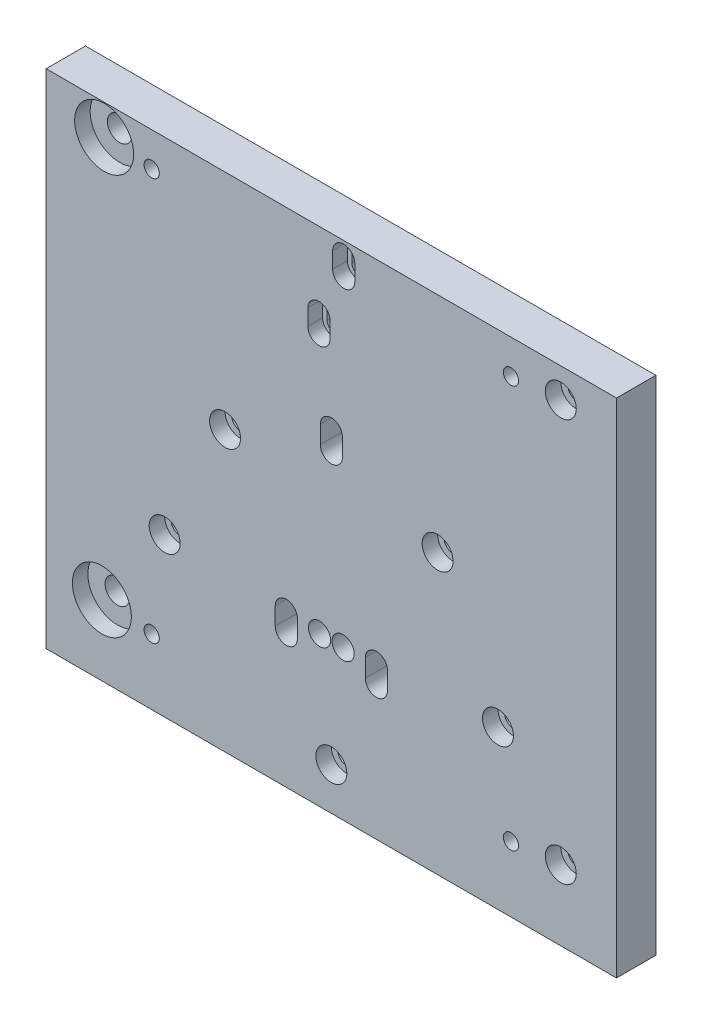
from build123d import *

# Parameters (mm, degrees)
SKETCH1_W                                      = 184.15
SKETCH1_H                                      = 146.05
BOSS_EXTRUDE1_DEPTH                            = 12.7
SKETCH5_W                                      = 184.15
SKETCH5_H                                      = 12.7
BOSS_EXTRUDE2_DEPTH                            = 16.125
CBORE_FOR_M5_SHCS2_D                           = 5.8
CBORE_FOR_M5_SHCS2_CBORE_D                     = 10
CBORE_FOR_M5_SHCS2_CBORE_DEPTH                 = 5
CBORE_FOR_M5_SHCS3_D                           = 5.3
CBORE_FOR_M5_SHCS3_CBORE_D                     = 10
CBORE_FOR_M5_SHCS3_CBORE_DEPTH                 = 5
CBORE_START                                    = 5.3848
CBORE_SLOT_FOR_6_SOCKET_HEAD_CAP_SCREW1_DEPTH  = 7.3152
CBORE_SLOT_FOR_6_SOCKET_HEAD_CAP_SC_3_DEPTH    = 5.3848
CBORE_FOR_6_SOCKET_HEAD_CAP_SCREW1_D           = 4.3053
CBORE_FOR_6_SOCKET_HEAD_CAP_SCREW1_CBORE_D     = 7.14502
CBORE_FOR_6_SOCKET_HEAD_CAP_SCREW1_CBORE_DEPTH = 7.3152
F_8_CLEARANCE_HOLE1_D                          = 4.9149
CBORE_SLOT_FOR_6_SOCKET_HEAD_CAP_SCREW2_DEPTH  = 12.7
CBORE_START_2                                  = 7.9248
CBORE_SLOT_FOR_6_SOCKET_HEAD_CAP_SC_5_DEPTH    = 4.7752
SKETCH24_R                                     = 9.525
CUT_EXTRUDE2_DEPTH                             = 3.175
CUT_EXTRUDE3_REACH                             = 286.439
SKETCH25_R                                     = 3.96875
SKETCH26_R                                     = 9.525
CUT_EXTRUDE4_DEPTH                             = 5


# Read off the part's stored shape, not the designer's step: CBORE SLOT for #6 Socket Head Cap Screw1, CBORE SLOT for #6 Socket Head Cap Screw2
with BuildPart() as part:
    # Sketch1 → Boss-Extrude1 (new body)
    with BuildSketch(Plane.XY):
        with Locations((-90.01, -129)):
            Rectangle(SKETCH1_W, SKETCH1_H)
    extrude(amount=BOSS_EXTRUDE1_DEPTH)

    # Sketch5 → Boss-Extrude2 (add)
    with BuildSketch(Plane.XZ.offset(202.025)):
        with Locations((-90.01, 6.35)):
            Rectangle(SKETCH5_W, SKETCH5_H)
    extrude(amount=BOSS_EXTRUDE2_DEPTH)

    # CBORE for M5 SHCS2 (through all)
    with Locations(Plane.XY.offset(12.7)):
        with Locations((-55.7, -127.988675216), (-124.32, -127.988675216), (-90.01, -204.53125), (-143.810885302, -167.1), (-36.209114698, -167.1)):
            CounterBoreHole(CBORE_FOR_M5_SHCS2_D / 2, CBORE_FOR_M5_SHCS2_CBORE_D / 2, CBORE_FOR_M5_SHCS2_CBORE_DEPTH)

    # CBORE for M5 SHCS3 (through all)
    with Locations(Plane.XY.offset(12.7)):
        with Locations((-15.925, -65.5), (-15.925, -195.488675216), (-164.095, -195.488675216), (-163.361007118, -65.792154837)):
            CounterBoreHole(CBORE_FOR_M5_SHCS3_D / 2, CBORE_FOR_M5_SHCS3_CBORE_D / 2, CBORE_FOR_M5_SHCS3_CBORE_DEPTH)

    # CBORE SLOT for _6 Socket Head Cap Sc 2 → CBORE SLOT for #6 Socket Head Cap Screw1 (cut)
    with BuildSketch(Plane.XY.offset(CBORE_START)):
        with BuildLine():
            Line((-71.896135914, -174.858973451), (-71.896135914, -169.131273451))
            ThreePointArc((-71.896135914, -169.131273451), (-75.468645914, -165.558763451), (-79.041155914, -169.131273451))
            Line((-79.041155914, -169.131273451), (-79.041155914, -174.858973451))
            ThreePointArc((-79.041155914, -174.858973451), (-75.468645914, -178.431483451), (-71.896135914, -174.858973451))
        make_face()
        with BuildLine():
            Line((-100.978844086, -174.858973451), (-100.978844086, -169.131273451))
            ThreePointArc((-100.978844086, -169.131273451), (-104.551354086, -165.558763451), (-108.123864086, -169.131273451))
            Line((-108.123864086, -169.131273451), (-108.123864086, -174.858973451))
            ThreePointArc((-108.123864086, -174.858973451), (-104.551354086, -178.431483451), (-100.978844086, -174.858973451))
        make_face()
        with BuildLine():
            Line((-86.43749, -116.838826563), (-86.43749, -111.111126563))
            ThreePointArc((-86.43749, -111.111126563), (-90.01, -107.538616563), (-93.58251, -111.111126563))
            Line((-93.58251, -111.111126563), (-93.58251, -116.838826563))
            ThreePointArc((-93.58251, -116.838826563), (-90.01, -120.411336563), (-86.43749, -116.838826563))
        make_face()
    extrude(amount=CBORE_SLOT_FOR_6_SOCKET_HEAD_CAP_SCREW1_DEPTH, mode=Mode.SUBTRACT)

    # CBORE SLOT for _6 Socket Head Cap Sc 3 o → CBORE SLOT for _6 Socket Head Cap Sc 3 (cut)
    with BuildSketch(Plane.XY):
        with BuildLine():
            Line((-73.569995914, -174.858973451), (-73.569995914, -169.131273451))
            ThreePointArc((-73.569995914, -169.131273451), (-75.468645914, -167.232623451), (-77.367295914, -169.131273451))
            Line((-77.367295914, -169.131273451), (-77.367295914, -174.858973451))
            ThreePointArc((-77.367295914, -174.858973451), (-75.468645914, -176.757623451), (-73.569995914, -174.858973451))
        make_face()
        with BuildLine():
            Line((-102.652704086, -174.858973451), (-102.652704086, -169.131273451))
            ThreePointArc((-102.652704086, -169.131273451), (-104.551354086, -167.232623451), (-106.450004086, -169.131273451))
            Line((-106.450004086, -169.131273451), (-106.450004086, -174.858973451))
            ThreePointArc((-106.450004086, -174.858973451), (-104.551354086, -176.757623451), (-102.652704086, -174.858973451))
        make_face()
        with BuildLine():
            Line((-88.11135, -116.838826563), (-88.11135, -111.111126563))
            ThreePointArc((-88.11135, -111.111126563), (-90.01, -109.212476563), (-91.90865, -111.111126563))
            Line((-91.90865, -111.111126563), (-91.90865, -116.838826563))
            ThreePointArc((-91.90865, -116.838826563), (-90.01, -118.737476563), (-88.11135, -116.838826563))
        make_face()
    extrude(amount=CBORE_SLOT_FOR_6_SOCKET_HEAD_CAP_SC_3_DEPTH, mode=Mode.SUBTRACT)

    # CBORE for #6 Socket Head Cap Screw1 (through all)
    with Locations(Plane.XY.offset(12.7)):
        with Locations((-93.82, -169.850123451), (-86.2, -169.850123451)):
            CounterBoreHole(CBORE_FOR_6_SOCKET_HEAD_CAP_SCREW1_D / 2, CBORE_FOR_6_SOCKET_HEAD_CAP_SCREW1_CBORE_D / 2, CBORE_FOR_6_SOCKET_HEAD_CAP_SCREW1_CBORE_DEPTH)

    # #8 Clearance Hole1 (through all)
    with Locations(Plane.XY.offset(12.7)):
        with Locations((-32.01, -66.988675216), (-148.01, -66.988675216), (-148.01, -196.988675216), (-32.01, -196.988675216)):
            Hole(F_8_CLEARANCE_HOLE1_D / 2)

    # CBORE SLOT for _6 Socket Head Cap Sc 4 → CBORE SLOT for #6 Socket Head Cap Screw2 (cut)
    with BuildSketch(Plane.XY):
        with BuildLine():
            Line((-83.85735, -65.78485), (-83.85735, -60.56515))
            ThreePointArc((-83.85735, -60.56515), (-86.01, -58.4125), (-88.16265, -60.56515))
            Line((-88.16265, -60.56515), (-88.16265, -65.78485))
            ThreePointArc((-88.16265, -65.78485), (-86.01, -67.9375), (-83.85735, -65.78485))
        make_face()
        with BuildLine():
            Line((-91.85735, -85.78485), (-91.85735, -80.56515))
            ThreePointArc((-91.85735, -80.56515), (-94.01, -78.4125), (-96.16265, -80.56515))
            Line((-96.16265, -80.56515), (-96.16265, -85.78485))
            ThreePointArc((-96.16265, -85.78485), (-94.01, -87.9375), (-91.85735, -85.78485))
        make_face()
    extrude(amount=CBORE_SLOT_FOR_6_SOCKET_HEAD_CAP_SCREW2_DEPTH, mode=Mode.SUBTRACT)

    # CBORE SLOT for _6 Socket Head Cap Sc 5 o → CBORE SLOT for _6 Socket Head Cap Sc 5 (cut)
    # profile 1 of 2: a face of its own
    with BuildSketch(Plane.XY.offset(CBORE_START_2)):
        with BuildLine():
            Line((-82.43749, -65.78485), (-82.43749, -60.56515))
            ThreePointArc((-82.43749, -60.56515), (-86.01, -56.99264), (-89.58251, -60.56515))
            Line((-89.58251, -60.56515), (-89.58251, -65.78485))
            ThreePointArc((-89.58251, -65.78485), (-86.01, -69.35736), (-82.43749, -65.78485))
        make_face()
        with BuildLine():
            ThreePointArc((-88.16265, -60.56515), (-86.01, -58.4125), (-83.85735, -60.56515))
            Line((-83.85735, -60.56515), (-83.85735, -65.78485))
            ThreePointArc((-83.85735, -65.78485), (-86.01, -67.9375), (-88.16265, -65.78485))
            Line((-88.16265, -65.78485), (-88.16265, -60.56515))
        make_face(mode=Mode.SUBTRACT)
    # profile 2 of 2: a face of its own
    with BuildSketch(Plane.XY.offset(CBORE_START_2)):
        with BuildLine():
            Line((-90.43749, -85.78485), (-90.43749, -80.56515))
            ThreePointArc((-90.43749, -80.56515), (-94.01, -76.99264), (-97.58251, -80.56515))
            Line((-97.58251, -80.56515), (-97.58251, -85.78485))
            ThreePointArc((-97.58251, -85.78485), (-94.01, -89.35736), (-90.43749, -85.78485))
        make_face()
        with BuildLine():
            ThreePointArc((-96.16265, -80.56515), (-94.01, -78.4125), (-91.85735, -80.56515))
            Line((-91.85735, -80.56515), (-91.85735, -85.78485))
            ThreePointArc((-91.85735, -85.78485), (-94.01, -87.9375), (-96.16265, -85.78485))
            Line((-96.16265, -85.78485), (-96.16265, -80.56515))
        make_face(mode=Mode.SUBTRACT)
    extrude(amount=CBORE_SLOT_FOR_6_SOCKET_HEAD_CAP_SC_5_DEPTH, mode=Mode.SUBTRACT)

    # Sketch24 → Cut-Extrude2 (cut)
    with BuildSketch(Plane(origin=(0, 0, 0), x_dir=(-1, 0, 0), z_dir=(0, 0, -1))):
        with Locations((148.01, -66.988675216)):
            Circle(SKETCH24_R)
        with Locations((32.01, -66.988675216)):
            Circle(SKETCH24_R)
        with Locations((32.01, -196.988675216)):
            Circle(SKETCH24_R)
        with Locations((148.01, -196.988675216)):
            Circle(SKETCH24_R)
    extrude(amount=-CUT_EXTRUDE2_DEPTH, mode=Mode.SUBTRACT)

    # Sketch25 → Cut-Extrude3 (cut, up to next)
    with BuildSketch(Plane.XY.offset(12.7), mode=Mode.PRIVATE) as cut_extrude3_sk1:
        with Locations((-163.361007118, -65.792154837)):
            Circle(SKETCH25_R)
    cut_extrude3_tool1 = extrude(cut_extrude3_sk1.sketch, amount=-CUT_EXTRUDE3_REACH, mode=Mode.PRIVATE) & part.part
    # Sketch25 → Cut-Extrude3 (cut, up to next)
    with BuildSketch(Plane.XY.offset(12.7), mode=Mode.PRIVATE) as cut_extrude3_sk2:
        with Locations((-164.095, -195.488675216)):
            Circle(SKETCH25_R)
    cut_extrude3_tool2 = extrude(cut_extrude3_sk2.sketch, amount=-CUT_EXTRUDE3_REACH, mode=Mode.PRIVATE) & part.part
    add(cut_extrude3_tool1.solids().sort_by_distance((-163.361007, -65.792155, 12.7))[0], mode=Mode.SUBTRACT)
    add(cut_extrude3_tool2.solids().sort_by_distance((-164.095, -195.488675, 12.7))[0], mode=Mode.SUBTRACT)

    # Sketch26 → Cut-Extrude4 (cut)
    with BuildSketch(Plane.XY.offset(12.7)):
        with Locations((-164.095, -195.488675216)):
            Circle(SKETCH26_R)
        with Locations((-163.361007118, -65.792154837)):
            Circle(SKETCH26_R)
    extrude(amount=-CUT_EXTRUDE4_DEPTH, mode=Mode.SUBTRACT)


solid = part.part
